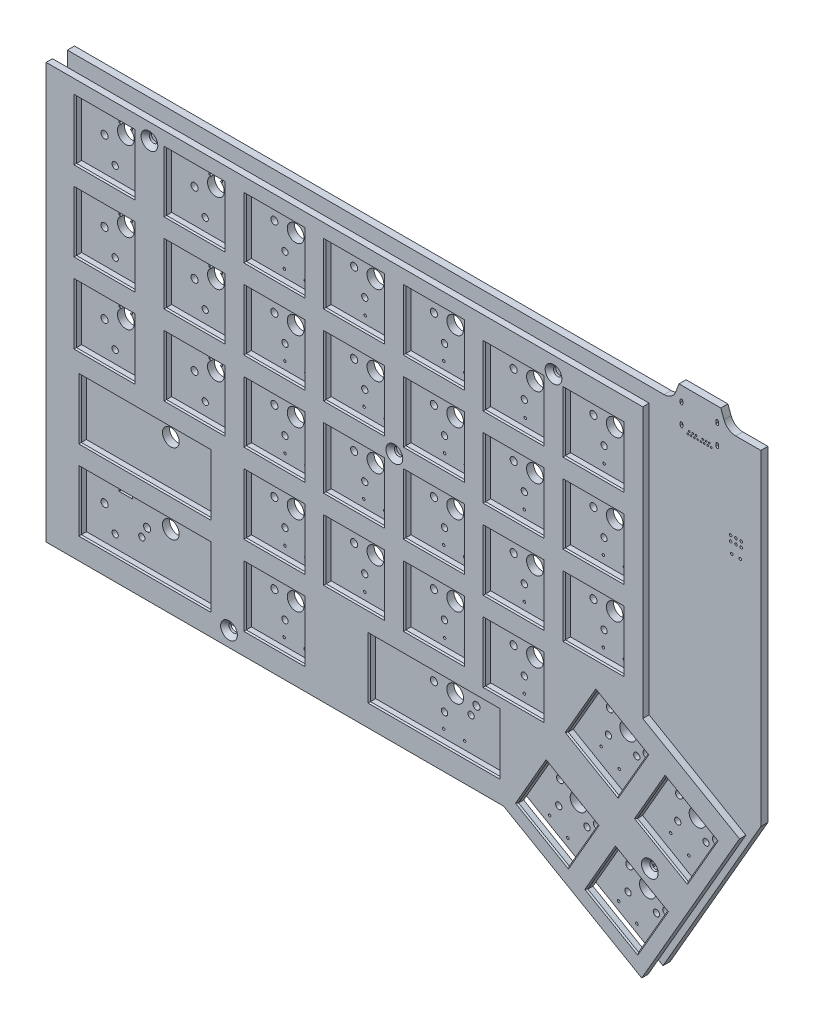
from build123d import *

# Parameters (mm, degrees)
BOSS_EXTRUDE1_START       = -1.69143934
BOSS_EXTRUDE1_OUTLINE_R   = 0.2999994
BOSS_EXTRUDE1_OUTLINE_R_2 = 0.7499985
BOSS_EXTRUDE1_OUTLINE_R_3 = 0.850000024
BOSS_EXTRUDE1_OUTLINE_R_4 = 2
BOSS_EXTRUDE1_OUTLINE_W   = 3.200004578
BOSS_EXTRUDE1_OUTLINE_H   = 2.799999237
BOSS_EXTRUDE1_OUTLINE_W_2 = 3.199996948
BOSS_EXTRUDE1_OUTLINE_H_2 = 2.800003052
BOSS_EXTRUDE1_OUTLINE_W_3 = 3.200000763
BOSS_EXTRUDE1_OUTLINE_W_4 = 3.199999809
BOSS_EXTRUDE1_OUTLINE_H_3 = 2.799995422
BOSS_EXTRUDE1_OUTLINE_R_5 = 0.1999996
BOSS_EXTRUDE1_DEPTH       = 1.69143934
SKETCH2_W                 = 14
SKETCH2_H                 = 14
BOSS_EXTRUDE2_DEPTH       = 5.08
CUT_EXTRUDE1_DEPTH        = 3.556
CHAMFER1_SIZE             = 0.3
SKETCH13_R                = 1
CUT_EXTRUDE5_DEPTH        = 10
CHAMFER2_SIZE             = 1
SKETCH14_W                = 142.472083827
SKETCH14_H                = 1.5
CUT_EXTRUDE6_DEPTH        = 3.556


with BuildPart() as part:
    # Boss-Extrude1: read off the stored shape, not the designer's step
    # Boss-Extrude1 outline → Boss-Extrude1 (new body)
    with BuildSketch(Plane(origin=(0, 0, -1.69143934), x_dir=(-1, 0, 0), z_dir=(0, 0, -1)).offset(BOSS_EXTRUDE1_START)):
        with BuildLine():
            Line((-105.828579714, 28.936268203), (3.414418806, 28.936268203))
            Line((3.414418806, 28.936268203), (3.414418806, 128.136993408))
            Line((3.414418806, 128.136993408), (-139.057665021, 128.136993408))
            ThreePointArc((-139.057665021, 128.136993408), (-140.77192707, 128.675652414), (-141.869995117, 130.098007665))
            Line((-141.869995117, 130.098007665), (-142.623001099, 132.136993871))
            Line((-142.623001099, 132.136993871), (-152.623001099, 132.136993871))
            Line((-152.623001099, 132.136993871), (-153.37600708, 130.098007665))
            ThreePointArc((-153.37600708, 130.098007665), (-154.474075127, 128.675652414), (-156.188337176, 128.136993408))
            Line((-156.188337176, 128.136993408), (-162.162994385, 128.136993408))
            Line((-162.162994385, 128.136993408), (-162.162994385, 50.337001801))
            Line((-162.162994385, 50.337001801), (-138.81300354, 9.892999649))
            Line((-138.81300354, 9.892999649), (-105.828579714, 28.936268203))
        make_face()
        with Locations((-132.5650892, 15.4500072)):
            Circle(BOSS_EXTRUDE1_OUTLINE_R, mode=Mode.SUBTRACT)
        with Locations((-137.2306628, 19.99615)):
            Circle(BOSS_EXTRUDE1_OUTLINE_R_2, mode=Mode.SUBTRACT)
        with Locations((-139.600997925, 21.561000824)):
            Circle(BOSS_EXTRUDE1_OUTLINE_R_3, mode=Mode.SUBTRACT)
        with Locations((-135.201004028, 24.100999832)):
            Circle(BOSS_EXTRUDE1_OUTLINE_R_4, mode=Mode.SUBTRACT)
        with Locations((-128.234948, 17.9499768)):
            Circle(BOSS_EXTRUDE1_OUTLINE_R, mode=Mode.SUBTRACT)
        with Locations((-130.4614104, 20.9714592)):
            Circle(BOSS_EXTRUDE1_OUTLINE_R_2, mode=Mode.SUBTRACT)
        with Locations((-144.9650644, 35.749992)):
            Circle(BOSS_EXTRUDE1_OUTLINE_R, mode=Mode.SUBTRACT)
        Polygon((-137.315002441, 30.962999344), (-135.91521916, 28.537869719), (-138.687222333, 26.937871245), (-140.087005615, 29.36300087), align=None, mode=Mode.SUBTRACT)
        with Locations((-130.802001953, 26.641000748)):
            Circle(BOSS_EXTRUDE1_OUTLINE_R_3, mode=Mode.SUBTRACT)
        with Locations((-123.050003052, 31.108999252)):
            Circle(BOSS_EXTRUDE1_OUTLINE_R_3, mode=Mode.SUBTRACT)
        with Locations((-140.6349232, 38.2500124)):
            Circle(BOSS_EXTRUDE1_OUTLINE_R, mode=Mode.SUBTRACT)
        Polygon((-120.76499939, 40.511001587), (-119.364835204, 38.086092449), (-122.135838927, 36.48609016), (-123.536003113, 38.910999298), align=None, mode=Mode.SUBTRACT)
        with Locations((-116.065046, 24.9500136)):
            Circle(BOSS_EXTRUDE1_OUTLINE_R, mode=Mode.SUBTRACT)
        with Locations((-111.7349556, 27.4499832)):
            Circle(BOSS_EXTRUDE1_OUTLINE_R, mode=Mode.SUBTRACT)
        with Locations((-120.6798196, 29.5438576)):
            Circle(BOSS_EXTRUDE1_OUTLINE_R_2, mode=Mode.SUBTRACT)
        with Locations((-113.9105672, 30.5191668)):
            Circle(BOSS_EXTRUDE1_OUTLINE_R_2, mode=Mode.SUBTRACT)
        with Locations((-118.650001526, 33.64899826)):
            Circle(BOSS_EXTRUDE1_OUTLINE_R_4, mode=Mode.SUBTRACT)
        with Locations((-114.250999451, 36.188999176)):
            Circle(BOSS_EXTRUDE1_OUTLINE_R_3, mode=Mode.SUBTRACT)
        with Locations((-91.4347676, 32.7000108)):
            Circle(BOSS_EXTRUDE1_OUTLINE_R, mode=Mode.SUBTRACT)
        with Locations((-86.4347776, 32.7000108)):
            Circle(BOSS_EXTRUDE1_OUTLINE_R, mode=Mode.SUBTRACT)
        with Locations((-92.9947848, 38.8345172)):
            Circle(BOSS_EXTRUDE1_OUTLINE_R_2, mode=Mode.SUBTRACT)
        with Locations((-86.6447848, 36.2945172)):
            Circle(BOSS_EXTRUDE1_OUTLINE_R_2, mode=Mode.SUBTRACT)
        with Locations((-151.464996338, 42.130001068)):
            Circle(BOSS_EXTRUDE1_OUTLINE_R_3, mode=Mode.SUBTRACT)
        with Locations((-149.095206, 40.5649684)):
            Circle(BOSS_EXTRUDE1_OUTLINE_R_2, mode=Mode.SUBTRACT)
        with Locations((-142.3259536, 41.5402776)):
            Circle(BOSS_EXTRUDE1_OUTLINE_R_2, mode=Mode.SUBTRACT)
        with Locations((-147.065994263, 44.669998169)):
            Circle(BOSS_EXTRUDE1_OUTLINE_R_4, mode=Mode.SUBTRACT)
        with Locations((-142.666000366, 47.209999084)):
            Circle(BOSS_EXTRUDE1_OUTLINE_R_3, mode=Mode.SUBTRACT)
        Polygon((-149.179992676, 51.532001495), (-147.779833289, 49.107093991), (-150.550831546, 47.507099264), (-151.950990933, 49.932006768), align=None, mode=Mode.SUBTRACT)
        with Locations((-128.3650468, 45.3500236)):
            Circle(BOSS_EXTRUDE1_OUTLINE_R, mode=Mode.SUBTRACT)
        with Locations((-124.0349564, 47.8499932)):
            Circle(BOSS_EXTRUDE1_OUTLINE_R, mode=Mode.SUBTRACT)
        with Locations((-134.914001465, 51.678001404)):
            Circle(BOSS_EXTRUDE1_OUTLINE_R_3, mode=Mode.SUBTRACT)
        with Locations((-132.5443628, 50.11293)):
            Circle(BOSS_EXTRUDE1_OUTLINE_R_2, mode=Mode.SUBTRACT)
        with Locations((-125.7750596, 51.0882392)):
            Circle(BOSS_EXTRUDE1_OUTLINE_R_2, mode=Mode.SUBTRACT)
        with Locations((-130.51499939, 54.217998505)):
            Circle(BOSS_EXTRUDE1_OUTLINE_R_4, mode=Mode.SUBTRACT)
        Polygon((-132.628997803, 61.080001831), (-131.228832634, 58.655097666), (-133.999828727, 57.055095377), (-135.399993896, 59.479999542), align=None, mode=Mode.SUBTRACT)
        with Locations((-126.114997864, 56.75799942)):
            Circle(BOSS_EXTRUDE1_OUTLINE_R_3, mode=Mode.SUBTRACT)
        with Locations((-129.5827228, 68.6000152)):
            Circle(BOSS_EXTRUDE1_OUTLINE_R, mode=Mode.SUBTRACT)
        with Locations((-124.582682, 68.6000152)):
            Circle(BOSS_EXTRUDE1_OUTLINE_R, mode=Mode.SUBTRACT)
        with Locations((-110.7000072, 49.6000024)):
            Circle(BOSS_EXTRUDE1_OUTLINE_R, mode=Mode.SUBTRACT)
        with Locations((-105.7000172, 49.6000024)):
            Circle(BOSS_EXTRUDE1_OUTLINE_R, mode=Mode.SUBTRACT)
        with Locations((-105.6947848, 53.2750268)):
            Circle(BOSS_EXTRUDE1_OUTLINE_R_2, mode=Mode.SUBTRACT)
        with Locations((-94.26499939, 41.375)):
            Circle(BOSS_EXTRUDE1_OUTLINE_R_3, mode=Mode.SUBTRACT)
        with Locations((-89.184997559, 41.375)):
            Circle(BOSS_EXTRUDE1_OUTLINE_R_4, mode=Mode.SUBTRACT)
        with Locations((-84.105003357, 41.375)):
            Circle(BOSS_EXTRUDE1_OUTLINE_R_3, mode=Mode.SUBTRACT)
        with Locations((-89.185001373, 46.975000382)):
            Rectangle(BOSS_EXTRUDE1_OUTLINE_W, BOSS_EXTRUDE1_OUTLINE_H, mode=Mode.SUBTRACT)
        with Locations((-91.6447748, 51.5999984)):
            Circle(BOSS_EXTRUDE1_OUTLINE_R, mode=Mode.SUBTRACT)
        with Locations((-86.6447848, 51.5999984)):
            Circle(BOSS_EXTRUDE1_OUTLINE_R, mode=Mode.SUBTRACT)
        with Locations((-86.6447848, 55.3445172)):
            Circle(BOSS_EXTRUDE1_OUTLINE_R_2, mode=Mode.SUBTRACT)
        with Locations((-112.0447848, 55.8150268)):
            Circle(BOSS_EXTRUDE1_OUTLINE_R_2, mode=Mode.SUBTRACT)
        with Locations((-113.315002441, 58.354999542)):
            Circle(BOSS_EXTRUDE1_OUTLINE_R_3, mode=Mode.SUBTRACT)
        with Locations((-108.23500061, 58.354999542)):
            Circle(BOSS_EXTRUDE1_OUTLINE_R_4, mode=Mode.SUBTRACT)
        with Locations((-103.154998779, 58.354999542)):
            Circle(BOSS_EXTRUDE1_OUTLINE_R_3, mode=Mode.SUBTRACT)
        with Locations((-110.7000072, 68.6000152)):
            Circle(BOSS_EXTRUDE1_OUTLINE_R, mode=Mode.SUBTRACT)
        with Locations((-108.23500061, 63.955001831)):
            Rectangle(BOSS_EXTRUDE1_OUTLINE_W_2, BOSS_EXTRUDE1_OUTLINE_H_2, mode=Mode.SUBTRACT)
        with Locations((-105.7000172, 68.6000152)):
            Circle(BOSS_EXTRUDE1_OUTLINE_R, mode=Mode.SUBTRACT)
        with Locations((-92.9947848, 57.8845172)):
            Circle(BOSS_EXTRUDE1_OUTLINE_R_2, mode=Mode.SUBTRACT)
        with Locations((-94.26499939, 60.424999237)):
            Circle(BOSS_EXTRUDE1_OUTLINE_R_3, mode=Mode.SUBTRACT)
        with Locations((-89.184997559, 60.424999237)):
            Circle(BOSS_EXTRUDE1_OUTLINE_R_4, mode=Mode.SUBTRACT)
        with Locations((-84.105003357, 60.424999237)):
            Circle(BOSS_EXTRUDE1_OUTLINE_R_3, mode=Mode.SUBTRACT)
        with Locations((-91.4347676, 70.6999856)):
            Circle(BOSS_EXTRUDE1_OUTLINE_R, mode=Mode.SUBTRACT)
        with Locations((-89.185001373, 66.025001526)):
            Rectangle(BOSS_EXTRUDE1_OUTLINE_W, BOSS_EXTRUDE1_OUTLINE_H_2, mode=Mode.SUBTRACT)
        with Locations((-86.4347776, 70.6999856)):
            Circle(BOSS_EXTRUDE1_OUTLINE_R, mode=Mode.SUBTRACT)
        with Locations((-53.3347676, 32.5999856)):
            Circle(BOSS_EXTRUDE1_OUTLINE_R, mode=Mode.SUBTRACT)
        with Locations((-48.3347776, 32.5999856)):
            Circle(BOSS_EXTRUDE1_OUTLINE_R, mode=Mode.SUBTRACT)
        with Locations((-48.5447848, 36.2945172)):
            Circle(BOSS_EXTRUDE1_OUTLINE_R_2, mode=Mode.SUBTRACT)
        with Locations((-54.8947848, 38.8345172)):
            Circle(BOSS_EXTRUDE1_OUTLINE_R_2, mode=Mode.SUBTRACT)
        with Locations((-34.2847676, 30.100016)):
            Circle(BOSS_EXTRUDE1_OUTLINE_R, mode=Mode.SUBTRACT)
        with Locations((-29.2847776, 30.100016)):
            Circle(BOSS_EXTRUDE1_OUTLINE_R, mode=Mode.SUBTRACT)
        with Locations((-12.9947924, 30.100016)):
            Circle(BOSS_EXTRUDE1_OUTLINE_R, mode=Mode.SUBTRACT)
        with Locations((-7.9948024, 30.100016)):
            Circle(BOSS_EXTRUDE1_OUTLINE_R, mode=Mode.SUBTRACT)
        with Locations((-14.3448024, 36.3265212)):
            Circle(BOSS_EXTRUDE1_OUTLINE_R_2, mode=Mode.SUBTRACT)
        with Locations((-7.9948024, 33.7865212)):
            Circle(BOSS_EXTRUDE1_OUTLINE_R_2, mode=Mode.SUBTRACT)
        with Locations((-15.614999771, 38.86700058)):
            Circle(BOSS_EXTRUDE1_OUTLINE_R_3, mode=Mode.SUBTRACT)
        with Locations((-5.454999924, 38.86700058)):
            Circle(BOSS_EXTRUDE1_OUTLINE_R_3, mode=Mode.SUBTRACT)
        with Locations((-72.5947748, 51.5999984)):
            Circle(BOSS_EXTRUDE1_OUTLINE_R, mode=Mode.SUBTRACT)
        with Locations((-67.5947848, 51.5999984)):
            Circle(BOSS_EXTRUDE1_OUTLINE_R, mode=Mode.SUBTRACT)
        with Locations((-67.5947848, 55.3445172)):
            Circle(BOSS_EXTRUDE1_OUTLINE_R_2, mode=Mode.SUBTRACT)
        with Locations((-56.165000916, 41.375)):
            Circle(BOSS_EXTRUDE1_OUTLINE_R_3, mode=Mode.SUBTRACT)
        with Locations((-51.084999084, 41.375)):
            Circle(BOSS_EXTRUDE1_OUTLINE_R_4, mode=Mode.SUBTRACT)
        with Locations((-51.085000992, 46.975000382)):
            Rectangle(BOSS_EXTRUDE1_OUTLINE_W_3, BOSS_EXTRUDE1_OUTLINE_H, mode=Mode.SUBTRACT)
        with Locations((-46.005001068, 41.375)):
            Circle(BOSS_EXTRUDE1_OUTLINE_R_3, mode=Mode.SUBTRACT)
        with Locations((-53.542692, 51.5999984)):
            Circle(BOSS_EXTRUDE1_OUTLINE_R, mode=Mode.SUBTRACT)
        with Locations((-48.542702, 51.5999984)):
            Circle(BOSS_EXTRUDE1_OUTLINE_R, mode=Mode.SUBTRACT)
        with Locations((-48.5447848, 55.3445172)):
            Circle(BOSS_EXTRUDE1_OUTLINE_R_2, mode=Mode.SUBTRACT)
        with Locations((-73.9447848, 57.8845172)):
            Circle(BOSS_EXTRUDE1_OUTLINE_R_2, mode=Mode.SUBTRACT)
        with Locations((-75.214996338, 60.424999237)):
            Circle(BOSS_EXTRUDE1_OUTLINE_R_3, mode=Mode.SUBTRACT)
        with Locations((-70.135002136, 60.424999237)):
            Circle(BOSS_EXTRUDE1_OUTLINE_R_4, mode=Mode.SUBTRACT)
        with Locations((-65.055000305, 60.424999237)):
            Circle(BOSS_EXTRUDE1_OUTLINE_R_3, mode=Mode.SUBTRACT)
        with Locations((-70.135002136, 66.025001526)):
            Rectangle(BOSS_EXTRUDE1_OUTLINE_W_2, BOSS_EXTRUDE1_OUTLINE_H_2, mode=Mode.SUBTRACT)
        with Locations((-72.3847676, 70.6999856)):
            Circle(BOSS_EXTRUDE1_OUTLINE_R, mode=Mode.SUBTRACT)
        with Locations((-67.3847776, 70.6999856)):
            Circle(BOSS_EXTRUDE1_OUTLINE_R, mode=Mode.SUBTRACT)
        with Locations((-54.8947848, 57.8845172)):
            Circle(BOSS_EXTRUDE1_OUTLINE_R_2, mode=Mode.SUBTRACT)
        with Locations((-56.165000916, 60.424999237)):
            Circle(BOSS_EXTRUDE1_OUTLINE_R_3, mode=Mode.SUBTRACT)
        with Locations((-51.084999084, 60.424999237)):
            Circle(BOSS_EXTRUDE1_OUTLINE_R_4, mode=Mode.SUBTRACT)
        with Locations((-46.005001068, 60.424999237)):
            Circle(BOSS_EXTRUDE1_OUTLINE_R_3, mode=Mode.SUBTRACT)
        with Locations((-51.085000992, 66.025001526)):
            Rectangle(BOSS_EXTRUDE1_OUTLINE_W_3, BOSS_EXTRUDE1_OUTLINE_H_2, mode=Mode.SUBTRACT)
        with Locations((-53.542692, 70.6999856)):
            Circle(BOSS_EXTRUDE1_OUTLINE_R, mode=Mode.SUBTRACT)
        with Locations((-48.542702, 70.6999856)):
            Circle(BOSS_EXTRUDE1_OUTLINE_R, mode=Mode.SUBTRACT)
        with Locations((-21.284999847, 41.375)):
            Circle(BOSS_EXTRUDE1_OUTLINE_R_4, mode=Mode.SUBTRACT)
        with Locations((-34.4947748, 49.2000032)):
            Circle(BOSS_EXTRUDE1_OUTLINE_R, mode=Mode.SUBTRACT)
        with Locations((-29.4947848, 49.2000032)):
            Circle(BOSS_EXTRUDE1_OUTLINE_R, mode=Mode.SUBTRACT)
        with Locations((-10.535000325, 44.467000962)):
            Rectangle(BOSS_EXTRUDE1_OUTLINE_W_4, BOSS_EXTRUDE1_OUTLINE_H, mode=Mode.SUBTRACT)
        with Locations((-12.9947924, 49.2000032)):
            Circle(BOSS_EXTRUDE1_OUTLINE_R, mode=Mode.SUBTRACT)
        with Locations((-7.9948024, 49.2000032)):
            Circle(BOSS_EXTRUDE1_OUTLINE_R, mode=Mode.SUBTRACT)
        with Locations((-21.284999847, 60.424999237)):
            Circle(BOSS_EXTRUDE1_OUTLINE_R_4, mode=Mode.SUBTRACT)
        with Locations((-34.4947748, 68.200016)):
            Circle(BOSS_EXTRUDE1_OUTLINE_R, mode=Mode.SUBTRACT)
        with Locations((-29.4947848, 68.200016)):
            Circle(BOSS_EXTRUDE1_OUTLINE_R, mode=Mode.SUBTRACT)
        with Locations((-12.7847852, 68.200016)):
            Circle(BOSS_EXTRUDE1_OUTLINE_R, mode=Mode.SUBTRACT)
        with Locations((-7.7847952, 68.200016)):
            Circle(BOSS_EXTRUDE1_OUTLINE_R, mode=Mode.SUBTRACT)
        with Locations((-132.365005493, 77.404998779)):
            Circle(BOSS_EXTRUDE1_OUTLINE_R_3, mode=Mode.SUBTRACT)
        with Locations((-124.7447848, 72.3250268)):
            Circle(BOSS_EXTRUDE1_OUTLINE_R_2, mode=Mode.SUBTRACT)
        with Locations((-131.0947848, 74.8650268)):
            Circle(BOSS_EXTRUDE1_OUTLINE_R_2, mode=Mode.SUBTRACT)
        with Locations((-127.285003662, 77.404998779)):
            Circle(BOSS_EXTRUDE1_OUTLINE_R_4, mode=Mode.SUBTRACT)
        with Locations((-122.205001831, 77.404998779)):
            Circle(BOSS_EXTRUDE1_OUTLINE_R_3, mode=Mode.SUBTRACT)
        with Locations((-127.284996033, 83.005001068)):
            Rectangle(BOSS_EXTRUDE1_OUTLINE_W_2, BOSS_EXTRUDE1_OUTLINE_H_3, mode=Mode.SUBTRACT)
        with Locations((-129.5827228, 87.7000024)):
            Circle(BOSS_EXTRUDE1_OUTLINE_R, mode=Mode.SUBTRACT)
        with Locations((-124.582682, 87.7000024)):
            Circle(BOSS_EXTRUDE1_OUTLINE_R, mode=Mode.SUBTRACT)
        with Locations((-131.092702, 93.9152808)):
            Circle(BOSS_EXTRUDE1_OUTLINE_R_2, mode=Mode.SUBTRACT)
        with Locations((-124.742702, 91.3752808)):
            Circle(BOSS_EXTRUDE1_OUTLINE_R_2, mode=Mode.SUBTRACT)
        with Locations((-132.363006592, 96.455001831)):
            Circle(BOSS_EXTRUDE1_OUTLINE_R_3, mode=Mode.SUBTRACT)
        with Locations((-127.282997131, 96.455001831)):
            Circle(BOSS_EXTRUDE1_OUTLINE_R_4, mode=Mode.SUBTRACT)
        with Locations((-122.20300293, 96.455001831)):
            Circle(BOSS_EXTRUDE1_OUTLINE_R_3, mode=Mode.SUBTRACT)
        with Locations((-112.0447848, 74.8650268)):
            Circle(BOSS_EXTRUDE1_OUTLINE_R_2, mode=Mode.SUBTRACT)
        with Locations((-113.315002441, 77.404998779)):
            Circle(BOSS_EXTRUDE1_OUTLINE_R_3, mode=Mode.SUBTRACT)
        with Locations((-105.6947848, 72.3250268)):
            Circle(BOSS_EXTRUDE1_OUTLINE_R_2, mode=Mode.SUBTRACT)
        with Locations((-108.23500061, 77.404998779)):
            Circle(BOSS_EXTRUDE1_OUTLINE_R_4, mode=Mode.SUBTRACT)
        with Locations((-103.154998779, 77.404998779)):
            Circle(BOSS_EXTRUDE1_OUTLINE_R_3, mode=Mode.SUBTRACT)
        with Locations((-108.23500061, 83.005001068)):
            Rectangle(BOSS_EXTRUDE1_OUTLINE_W_2, BOSS_EXTRUDE1_OUTLINE_H_3, mode=Mode.SUBTRACT)
        with Locations((-92.9947848, 76.9345172)):
            Circle(BOSS_EXTRUDE1_OUTLINE_R_2, mode=Mode.SUBTRACT)
        with Locations((-86.6447848, 74.3945172)):
            Circle(BOSS_EXTRUDE1_OUTLINE_R_2, mode=Mode.SUBTRACT)
        with Locations((-94.26499939, 79.474998474)):
            Circle(BOSS_EXTRUDE1_OUTLINE_R_3, mode=Mode.SUBTRACT)
        with Locations((-89.184997559, 79.474998474)):
            Circle(BOSS_EXTRUDE1_OUTLINE_R_4, mode=Mode.SUBTRACT)
        with Locations((-84.105003357, 79.474998474)):
            Circle(BOSS_EXTRUDE1_OUTLINE_R_3, mode=Mode.SUBTRACT)
        with Locations((-89.185001373, 85.075000763)):
            Rectangle(BOSS_EXTRUDE1_OUTLINE_W, BOSS_EXTRUDE1_OUTLINE_H_3, mode=Mode.SUBTRACT)
        with Locations((-110.7000072, 87.7000024)):
            Circle(BOSS_EXTRUDE1_OUTLINE_R, mode=Mode.SUBTRACT)
        with Locations((-112.042702, 93.9152808)):
            Circle(BOSS_EXTRUDE1_OUTLINE_R_2, mode=Mode.SUBTRACT)
        with Locations((-105.7000172, 87.7000024)):
            Circle(BOSS_EXTRUDE1_OUTLINE_R, mode=Mode.SUBTRACT)
        with Locations((-105.692702, 91.3752808)):
            Circle(BOSS_EXTRUDE1_OUTLINE_R_2, mode=Mode.SUBTRACT)
        with Locations((-113.31300354, 96.455001831)):
            Circle(BOSS_EXTRUDE1_OUTLINE_R_3, mode=Mode.SUBTRACT)
        with Locations((-108.233001709, 96.455001831)):
            Circle(BOSS_EXTRUDE1_OUTLINE_R_4, mode=Mode.SUBTRACT)
        with Locations((-103.152999878, 96.455001831)):
            Circle(BOSS_EXTRUDE1_OUTLINE_R_3, mode=Mode.SUBTRACT)
        with Locations((-91.642692, 89.8000236)):
            Circle(BOSS_EXTRUDE1_OUTLINE_R, mode=Mode.SUBTRACT)
        with Locations((-86.642702, 89.8000236)):
            Circle(BOSS_EXTRUDE1_OUTLINE_R, mode=Mode.SUBTRACT)
        with Locations((-86.6447848, 93.4445172)):
            Circle(BOSS_EXTRUDE1_OUTLINE_R_2, mode=Mode.SUBTRACT)
        with Locations((-92.9947848, 95.9845172)):
            Circle(BOSS_EXTRUDE1_OUTLINE_R_2, mode=Mode.SUBTRACT)
        with Locations((-94.26499939, 98.525001526)):
            Circle(BOSS_EXTRUDE1_OUTLINE_R_3, mode=Mode.SUBTRACT)
        with Locations((-89.184997559, 98.525001526)):
            Circle(BOSS_EXTRUDE1_OUTLINE_R_4, mode=Mode.SUBTRACT)
        with Locations((-84.105003357, 98.525001526)):
            Circle(BOSS_EXTRUDE1_OUTLINE_R_3, mode=Mode.SUBTRACT)
        with Locations((-157.2500284, 103.249984)):
            Circle(BOSS_EXTRUDE1_OUTLINE_R, mode=Mode.SUBTRACT)
        with Locations((-155.2500324, 103.249984)):
            Circle(BOSS_EXTRUDE1_OUTLINE_R, mode=Mode.SUBTRACT)
        with Locations((-157.5000152, 105.7299892)):
            Circle(BOSS_EXTRUDE1_OUTLINE_R, mode=Mode.SUBTRACT)
        with Locations((-157.5000152, 106.9999892)):
            Circle(BOSS_EXTRUDE1_OUTLINE_R, mode=Mode.SUBTRACT)
        with Locations((-156.2300152, 105.7299892)):
            Circle(BOSS_EXTRUDE1_OUTLINE_R, mode=Mode.SUBTRACT)
        with Locations((-154.9600152, 105.7299892)):
            Circle(BOSS_EXTRUDE1_OUTLINE_R, mode=Mode.SUBTRACT)
        with Locations((-156.2300152, 106.9999892)):
            Circle(BOSS_EXTRUDE1_OUTLINE_R, mode=Mode.SUBTRACT)
        with Locations((-154.9600152, 106.9999892)):
            Circle(BOSS_EXTRUDE1_OUTLINE_R, mode=Mode.SUBTRACT)
        with Locations((-127.282997131, 102.055000305)):
            Rectangle(BOSS_EXTRUDE1_OUTLINE_W_2, BOSS_EXTRUDE1_OUTLINE_H_2, mode=Mode.SUBTRACT)
        with Locations((-129.742692, 106.7000152)):
            Circle(BOSS_EXTRUDE1_OUTLINE_R, mode=Mode.SUBTRACT)
        with Locations((-124.742702, 106.7000152)):
            Circle(BOSS_EXTRUDE1_OUTLINE_R, mode=Mode.SUBTRACT)
        with Locations((-132.363006592, 115.504997253)):
            Circle(BOSS_EXTRUDE1_OUTLINE_R_3, mode=Mode.SUBTRACT)
        with Locations((-131.092702, 112.9652808)):
            Circle(BOSS_EXTRUDE1_OUTLINE_R_2, mode=Mode.SUBTRACT)
        with Locations((-124.742702, 110.4252808)):
            Circle(BOSS_EXTRUDE1_OUTLINE_R_2, mode=Mode.SUBTRACT)
        with Locations((-127.282997131, 115.504997253)):
            Circle(BOSS_EXTRUDE1_OUTLINE_R_4, mode=Mode.SUBTRACT)
        with Locations((-122.20300293, 115.504997253)):
            Circle(BOSS_EXTRUDE1_OUTLINE_R_3, mode=Mode.SUBTRACT)
        with Locations((-150.2999788, 122.8200236)):
            Circle(BOSS_EXTRUDE1_OUTLINE_R_5, mode=Mode.SUBTRACT)
        with Locations((-149.4999804, 122.8200236)):
            Circle(BOSS_EXTRUDE1_OUTLINE_R_5, mode=Mode.SUBTRACT)
        with Locations((-149.8999796, 123.5199968)):
            Circle(BOSS_EXTRUDE1_OUTLINE_R_5, mode=Mode.SUBTRACT)
        with BuildLine():
            ThreePointArc((-151.469979, 123.6699838), (-151.7699784, 123.3699844), (-152.0699778, 123.6699838))
            Line((-152.0699778, 123.6699838), (-152.0699778, 124.2699826))
            ThreePointArc((-152.0699778, 124.2699826), (-151.7699784, 124.569982), (-151.469979, 124.2699826))
            Line((-151.469979, 124.2699826), (-151.469979, 123.6699838))
        make_face(mode=Mode.SUBTRACT)
        with Locations((-148.699982, 122.8200236)):
            Circle(BOSS_EXTRUDE1_OUTLINE_R_5, mode=Mode.SUBTRACT)
        with Locations((-149.0999812, 123.5199968)):
            Circle(BOSS_EXTRUDE1_OUTLINE_R_5, mode=Mode.SUBTRACT)
        with Locations((-148.2999828, 123.5199968)):
            Circle(BOSS_EXTRUDE1_OUTLINE_R_5, mode=Mode.SUBTRACT)
        with Locations((-147.8999836, 122.8200236)):
            Circle(BOSS_EXTRUDE1_OUTLINE_R_5, mode=Mode.SUBTRACT)
        with Locations((-147.0999852, 122.8200236)):
            Circle(BOSS_EXTRUDE1_OUTLINE_R_5, mode=Mode.SUBTRACT)
        with Locations((-146.699986, 123.5199968)):
            Circle(BOSS_EXTRUDE1_OUTLINE_R_5, mode=Mode.SUBTRACT)
        with Locations((-146.2999868, 122.8200236)):
            Circle(BOSS_EXTRUDE1_OUTLINE_R_5, mode=Mode.SUBTRACT)
        with Locations((-145.4999884, 122.8200236)):
            Circle(BOSS_EXTRUDE1_OUTLINE_R_5, mode=Mode.SUBTRACT)
        with Locations((-145.8999876, 123.5199968)):
            Circle(BOSS_EXTRUDE1_OUTLINE_R_5, mode=Mode.SUBTRACT)
        with Locations((-144.69999, 122.8200236)):
            Circle(BOSS_EXTRUDE1_OUTLINE_R_5, mode=Mode.SUBTRACT)
        with Locations((-145.0999892, 123.5199968)):
            Circle(BOSS_EXTRUDE1_OUTLINE_R_5, mode=Mode.SUBTRACT)
        with BuildLine():
            ThreePointArc((-142.929991, 123.6699838), (-143.2299904, 123.3699844), (-143.5299898, 123.6699838))
            Line((-143.5299898, 123.6699838), (-143.5299898, 124.2699826))
            ThreePointArc((-143.5299898, 124.2699826), (-143.2299904, 124.569982), (-142.929991, 124.2699826))
            Line((-142.929991, 124.2699826), (-142.929991, 123.6699838))
        make_face(mode=Mode.SUBTRACT)
        with BuildLine():
            ThreePointArc((-151.469979, 128.4000226), (-151.7699784, 128.1000232), (-152.0699778, 128.4000226))
            Line((-152.0699778, 128.4000226), (-152.0699778, 129.0000214))
            ThreePointArc((-152.0699778, 129.0000214), (-151.7699784, 129.3000208), (-151.469979, 129.0000214))
            Line((-151.469979, 129.0000214), (-151.469979, 128.4000226))
        make_face(mode=Mode.SUBTRACT)
        with BuildLine():
            ThreePointArc((-142.929991, 128.4000226), (-143.2299904, 128.1000232), (-143.5299898, 128.4000226))
            Line((-143.5299898, 128.4000226), (-143.5299898, 129.0000214))
            ThreePointArc((-143.5299898, 129.0000214), (-143.2299904, 129.3000208), (-142.929991, 129.0000214))
            Line((-142.929991, 129.0000214), (-142.929991, 128.4000226))
        make_face(mode=Mode.SUBTRACT)
        with Locations((-127.282997131, 121.104999542)):
            Rectangle(BOSS_EXTRUDE1_OUTLINE_W_2, BOSS_EXTRUDE1_OUTLINE_H_3, mode=Mode.SUBTRACT)
        with Locations((-110.932722, 106.7000152)):
            Circle(BOSS_EXTRUDE1_OUTLINE_R, mode=Mode.SUBTRACT)
        with Locations((-108.233001709, 102.055000305)):
            Rectangle(BOSS_EXTRUDE1_OUTLINE_W_2, BOSS_EXTRUDE1_OUTLINE_H_2, mode=Mode.SUBTRACT)
        with Locations((-105.9326812, 106.7000152)):
            Circle(BOSS_EXTRUDE1_OUTLINE_R, mode=Mode.SUBTRACT)
        with Locations((-112.042702, 112.9652808)):
            Circle(BOSS_EXTRUDE1_OUTLINE_R_2, mode=Mode.SUBTRACT)
        with Locations((-113.31300354, 115.504997253)):
            Circle(BOSS_EXTRUDE1_OUTLINE_R_3, mode=Mode.SUBTRACT)
        with Locations((-105.692702, 110.4252808)):
            Circle(BOSS_EXTRUDE1_OUTLINE_R_2, mode=Mode.SUBTRACT)
        with Locations((-108.233001709, 115.504997253)):
            Circle(BOSS_EXTRUDE1_OUTLINE_R_4, mode=Mode.SUBTRACT)
        with Locations((-103.152999878, 115.504997253)):
            Circle(BOSS_EXTRUDE1_OUTLINE_R_3, mode=Mode.SUBTRACT)
        with Locations((-91.4827228, 108.7999856)):
            Circle(BOSS_EXTRUDE1_OUTLINE_R, mode=Mode.SUBTRACT)
        with Locations((-89.185001373, 104.125)):
            Rectangle(BOSS_EXTRUDE1_OUTLINE_W, BOSS_EXTRUDE1_OUTLINE_H_2, mode=Mode.SUBTRACT)
        with Locations((-86.482682, 108.7999856)):
            Circle(BOSS_EXTRUDE1_OUTLINE_R, mode=Mode.SUBTRACT)
        with Locations((-92.992702, 115.0347712)):
            Circle(BOSS_EXTRUDE1_OUTLINE_R_2, mode=Mode.SUBTRACT)
        with Locations((-86.642702, 112.4947712)):
            Circle(BOSS_EXTRUDE1_OUTLINE_R_2, mode=Mode.SUBTRACT)
        with Locations((-108.233001709, 121.104999542)):
            Rectangle(BOSS_EXTRUDE1_OUTLINE_W_2, BOSS_EXTRUDE1_OUTLINE_H_3, mode=Mode.SUBTRACT)
        with Locations((-94.263000488, 117.574996948)):
            Circle(BOSS_EXTRUDE1_OUTLINE_R_3, mode=Mode.SUBTRACT)
        with Locations((-89.182998657, 117.574996948)):
            Circle(BOSS_EXTRUDE1_OUTLINE_R_4, mode=Mode.SUBTRACT)
        with Locations((-84.102996826, 117.574996948)):
            Circle(BOSS_EXTRUDE1_OUTLINE_R_3, mode=Mode.SUBTRACT)
        with Locations((-89.182998657, 123.174999237)):
            Rectangle(BOSS_EXTRUDE1_OUTLINE_W_2, BOSS_EXTRUDE1_OUTLINE_H_3, mode=Mode.SUBTRACT)
        with Locations((-73.9447848, 76.9345172)):
            Circle(BOSS_EXTRUDE1_OUTLINE_R_2, mode=Mode.SUBTRACT)
        with Locations((-67.5947848, 74.3945172)):
            Circle(BOSS_EXTRUDE1_OUTLINE_R_2, mode=Mode.SUBTRACT)
        with Locations((-75.214996338, 79.474998474)):
            Circle(BOSS_EXTRUDE1_OUTLINE_R_3, mode=Mode.SUBTRACT)
        with Locations((-70.135002136, 79.474998474)):
            Circle(BOSS_EXTRUDE1_OUTLINE_R_4, mode=Mode.SUBTRACT)
        with Locations((-70.135002136, 85.075000763)):
            Rectangle(BOSS_EXTRUDE1_OUTLINE_W_2, BOSS_EXTRUDE1_OUTLINE_H_3, mode=Mode.SUBTRACT)
        with Locations((-65.055000305, 79.474998474)):
            Circle(BOSS_EXTRUDE1_OUTLINE_R_3, mode=Mode.SUBTRACT)
        with Locations((-48.5447848, 74.3945172)):
            Circle(BOSS_EXTRUDE1_OUTLINE_R_2, mode=Mode.SUBTRACT)
        with Locations((-54.8947848, 76.9345172)):
            Circle(BOSS_EXTRUDE1_OUTLINE_R_2, mode=Mode.SUBTRACT)
        with Locations((-56.165000916, 79.474998474)):
            Circle(BOSS_EXTRUDE1_OUTLINE_R_3, mode=Mode.SUBTRACT)
        with Locations((-51.084999084, 79.474998474)):
            Circle(BOSS_EXTRUDE1_OUTLINE_R_4, mode=Mode.SUBTRACT)
        with Locations((-51.085000992, 85.075000763)):
            Rectangle(BOSS_EXTRUDE1_OUTLINE_W_3, BOSS_EXTRUDE1_OUTLINE_H_3, mode=Mode.SUBTRACT)
        with Locations((-46.005001068, 79.474998474)):
            Circle(BOSS_EXTRUDE1_OUTLINE_R_3, mode=Mode.SUBTRACT)
        with Locations((-72.4348056, 89.8000236)):
            Circle(BOSS_EXTRUDE1_OUTLINE_R, mode=Mode.SUBTRACT)
        with Locations((-67.4347648, 89.8000236)):
            Circle(BOSS_EXTRUDE1_OUTLINE_R, mode=Mode.SUBTRACT)
        with Locations((-67.5947848, 93.4445172)):
            Circle(BOSS_EXTRUDE1_OUTLINE_R_2, mode=Mode.SUBTRACT)
        with Locations((-73.9447848, 95.9845172)):
            Circle(BOSS_EXTRUDE1_OUTLINE_R_2, mode=Mode.SUBTRACT)
        with Locations((-75.214996338, 98.525001526)):
            Circle(BOSS_EXTRUDE1_OUTLINE_R_3, mode=Mode.SUBTRACT)
        with Locations((-70.135002136, 98.525001526)):
            Circle(BOSS_EXTRUDE1_OUTLINE_R_4, mode=Mode.SUBTRACT)
        with Locations((-65.055000305, 98.525001526)):
            Circle(BOSS_EXTRUDE1_OUTLINE_R_3, mode=Mode.SUBTRACT)
        with Locations((-53.542692, 89.8000236)):
            Circle(BOSS_EXTRUDE1_OUTLINE_R, mode=Mode.SUBTRACT)
        with Locations((-48.542702, 89.8000236)):
            Circle(BOSS_EXTRUDE1_OUTLINE_R, mode=Mode.SUBTRACT)
        with Locations((-48.5447848, 93.4445172)):
            Circle(BOSS_EXTRUDE1_OUTLINE_R_2, mode=Mode.SUBTRACT)
        with Locations((-54.8947848, 95.9845172)):
            Circle(BOSS_EXTRUDE1_OUTLINE_R_2, mode=Mode.SUBTRACT)
        with Locations((-56.165000916, 98.525001526)):
            Circle(BOSS_EXTRUDE1_OUTLINE_R_3, mode=Mode.SUBTRACT)
        with Locations((-51.084999084, 98.525001526)):
            Circle(BOSS_EXTRUDE1_OUTLINE_R_4, mode=Mode.SUBTRACT)
        with Locations((-46.005001068, 98.525001526)):
            Circle(BOSS_EXTRUDE1_OUTLINE_R_3, mode=Mode.SUBTRACT)
        with Locations((-35.8447848, 74.4265212)):
            Circle(BOSS_EXTRUDE1_OUTLINE_R_2, mode=Mode.SUBTRACT)
        with Locations((-29.4947848, 71.8865212)):
            Circle(BOSS_EXTRUDE1_OUTLINE_R_2, mode=Mode.SUBTRACT)
        with Locations((-37.115001678, 76.967002869)):
            Circle(BOSS_EXTRUDE1_OUTLINE_R_3, mode=Mode.SUBTRACT)
        with Locations((-26.954999924, 76.967002869)):
            Circle(BOSS_EXTRUDE1_OUTLINE_R_3, mode=Mode.SUBTRACT)
        with BuildLine():
            Line((-30.434999466, 81.166999817), (-30.968636187, 81.166999817))
            ThreePointArc((-30.968636187, 81.166999817), (-32.034999847, 77.474998474), (-33.101363508, 81.166999817))
            Line((-33.101363508, 81.166999817), (-33.634998322, 81.166999817))
            Line((-33.634998322, 81.166999817), (-33.634998322, 83.967002869))
            Line((-33.634998322, 83.967002869), (-30.434999466, 83.967002869))
            Line((-30.434999466, 83.967002869), (-30.434999466, 81.166999817))
        make_face(mode=Mode.SUBTRACT)
        with Locations((-14.3448024, 74.4265212)):
            Circle(BOSS_EXTRUDE1_OUTLINE_R_2, mode=Mode.SUBTRACT)
        with Locations((-7.9948024, 71.8865212)):
            Circle(BOSS_EXTRUDE1_OUTLINE_R_2, mode=Mode.SUBTRACT)
        with Locations((-15.614999771, 76.967002869)):
            Circle(BOSS_EXTRUDE1_OUTLINE_R_3, mode=Mode.SUBTRACT)
        with Locations((-5.454999924, 76.967002869)):
            Circle(BOSS_EXTRUDE1_OUTLINE_R_3, mode=Mode.SUBTRACT)
        with BuildLine():
            Line((-8.93500042, 81.166999817), (-9.468636187, 81.166999817))
            ThreePointArc((-9.468636187, 81.166999817), (-10.534999847, 77.474998474), (-11.601363508, 81.166999817))
            Line((-11.601363508, 81.166999817), (-12.135000229, 81.166999817))
            Line((-12.135000229, 81.166999817), (-12.135000229, 83.967002869))
            Line((-12.135000229, 83.967002869), (-8.93500042, 83.967002869))
            Line((-8.93500042, 83.967002869), (-8.93500042, 81.166999817))
        make_face(mode=Mode.SUBTRACT)
        with Locations((-34.4947748, 87.3000032)):
            Circle(BOSS_EXTRUDE1_OUTLINE_R, mode=Mode.SUBTRACT)
        with Locations((-29.4947848, 87.3000032)):
            Circle(BOSS_EXTRUDE1_OUTLINE_R, mode=Mode.SUBTRACT)
        with Locations((-35.8447848, 93.4765212)):
            Circle(BOSS_EXTRUDE1_OUTLINE_R_2, mode=Mode.SUBTRACT)
        with Locations((-29.4947848, 90.9365212)):
            Circle(BOSS_EXTRUDE1_OUTLINE_R_2, mode=Mode.SUBTRACT)
        with Locations((-37.115001678, 96.016998291)):
            Circle(BOSS_EXTRUDE1_OUTLINE_R_3, mode=Mode.SUBTRACT)
        with BuildLine():
            Line((-30.434999466, 100.217002869), (-30.968636187, 100.217002869))
            ThreePointArc((-30.968636187, 100.217002869), (-32.034999847, 96.525001526), (-33.101363508, 100.217002869))
            Line((-33.101363508, 100.217002869), (-33.634998322, 100.217002869))
            Line((-33.634998322, 100.217002869), (-33.634998322, 103.016998291))
            Line((-33.634998322, 103.016998291), (-30.434999466, 103.016998291))
            Line((-30.434999466, 103.016998291), (-30.434999466, 100.217002869))
        make_face(mode=Mode.SUBTRACT)
        with Locations((-26.954999924, 96.016998291)):
            Circle(BOSS_EXTRUDE1_OUTLINE_R_3, mode=Mode.SUBTRACT)
        with Locations((-12.8347724, 87.3000032)):
            Circle(BOSS_EXTRUDE1_OUTLINE_R, mode=Mode.SUBTRACT)
        with Locations((-7.8347824, 87.3000032)):
            Circle(BOSS_EXTRUDE1_OUTLINE_R, mode=Mode.SUBTRACT)
        with Locations((-14.3448024, 93.4765212)):
            Circle(BOSS_EXTRUDE1_OUTLINE_R_2, mode=Mode.SUBTRACT)
        with Locations((-7.9948024, 90.9365212)):
            Circle(BOSS_EXTRUDE1_OUTLINE_R_2, mode=Mode.SUBTRACT)
        with Locations((-15.614999771, 96.016998291)):
            Circle(BOSS_EXTRUDE1_OUTLINE_R_3, mode=Mode.SUBTRACT)
        with BuildLine():
            ThreePointArc((-9.468636187, 100.217002869), (-10.534999847, 96.525001526), (-11.601363508, 100.217002869))
            Line((-11.601363508, 100.217002869), (-12.135000229, 100.217002869))
            Line((-12.135000229, 100.217002869), (-12.135000229, 103.016998291))
            Line((-12.135000229, 103.016998291), (-8.93500042, 103.016998291))
            Line((-8.93500042, 103.016998291), (-8.93500042, 100.217002869))
            Line((-8.93500042, 100.217002869), (-9.468636187, 100.217002869))
        make_face(mode=Mode.SUBTRACT)
        with Locations((-5.454999924, 96.016998291)):
            Circle(BOSS_EXTRUDE1_OUTLINE_R_3, mode=Mode.SUBTRACT)
        with Locations((-70.135002136, 104.125)):
            Rectangle(BOSS_EXTRUDE1_OUTLINE_W_2, BOSS_EXTRUDE1_OUTLINE_H_2, mode=Mode.SUBTRACT)
        with Locations((-72.6999816, 108.7999856)):
            Circle(BOSS_EXTRUDE1_OUTLINE_R, mode=Mode.SUBTRACT)
        with Locations((-67.6999916, 108.7999856)):
            Circle(BOSS_EXTRUDE1_OUTLINE_R, mode=Mode.SUBTRACT)
        with Locations((-73.942702, 115.0347712)):
            Circle(BOSS_EXTRUDE1_OUTLINE_R_2, mode=Mode.SUBTRACT)
        with Locations((-67.592702, 112.4947712)):
            Circle(BOSS_EXTRUDE1_OUTLINE_R_2, mode=Mode.SUBTRACT)
        with Locations((-51.085000992, 104.125)):
            Rectangle(BOSS_EXTRUDE1_OUTLINE_W_3, BOSS_EXTRUDE1_OUTLINE_H_2, mode=Mode.SUBTRACT)
        with Locations((-53.3827228, 108.7999856)):
            Circle(BOSS_EXTRUDE1_OUTLINE_R, mode=Mode.SUBTRACT)
        with Locations((-48.382682, 108.7999856)):
            Circle(BOSS_EXTRUDE1_OUTLINE_R, mode=Mode.SUBTRACT)
        with Locations((-48.542702, 112.4947712)):
            Circle(BOSS_EXTRUDE1_OUTLINE_R_2, mode=Mode.SUBTRACT)
        with Locations((-54.892702, 115.0347712)):
            Circle(BOSS_EXTRUDE1_OUTLINE_R_2, mode=Mode.SUBTRACT)
        with Locations((-75.212997437, 117.574996948)):
            Circle(BOSS_EXTRUDE1_OUTLINE_R_3, mode=Mode.SUBTRACT)
        with Locations((-70.133003235, 117.574996948)):
            Circle(BOSS_EXTRUDE1_OUTLINE_R_4, mode=Mode.SUBTRACT)
        with Locations((-70.13299942, 123.174999237)):
            Rectangle(BOSS_EXTRUDE1_OUTLINE_W, BOSS_EXTRUDE1_OUTLINE_H_3, mode=Mode.SUBTRACT)
        with Locations((-65.053001404, 117.574996948)):
            Circle(BOSS_EXTRUDE1_OUTLINE_R_3, mode=Mode.SUBTRACT)
        with Locations((-56.162998199, 117.574996948)):
            Circle(BOSS_EXTRUDE1_OUTLINE_R_3, mode=Mode.SUBTRACT)
        with Locations((-51.083000183, 117.574996948)):
            Circle(BOSS_EXTRUDE1_OUTLINE_R_4, mode=Mode.SUBTRACT)
        with Locations((-51.083000183, 123.174999237)):
            Rectangle(BOSS_EXTRUDE1_OUTLINE_W_2, BOSS_EXTRUDE1_OUTLINE_H_3, mode=Mode.SUBTRACT)
        with Locations((-46.002998352, 117.574996948)):
            Circle(BOSS_EXTRUDE1_OUTLINE_R_3, mode=Mode.SUBTRACT)
        with Locations((-34.492692, 106.300016)):
            Circle(BOSS_EXTRUDE1_OUTLINE_R, mode=Mode.SUBTRACT)
        with Locations((-29.492702, 106.300016)):
            Circle(BOSS_EXTRUDE1_OUTLINE_R, mode=Mode.SUBTRACT)
        with Locations((-35.842702, 112.5267752)):
            Circle(BOSS_EXTRUDE1_OUTLINE_R_2, mode=Mode.SUBTRACT)
        with Locations((-29.492702, 109.9867752)):
            Circle(BOSS_EXTRUDE1_OUTLINE_R_2, mode=Mode.SUBTRACT)
        with Locations((-37.112998962, 115.067001343)):
            Circle(BOSS_EXTRUDE1_OUTLINE_R_3, mode=Mode.SUBTRACT)
        with Locations((-26.952999115, 115.067001343)):
            Circle(BOSS_EXTRUDE1_OUTLINE_R_3, mode=Mode.SUBTRACT)
        with Locations((-12.8326896, 106.300016)):
            Circle(BOSS_EXTRUDE1_OUTLINE_R, mode=Mode.SUBTRACT)
        with Locations((-7.8326996, 106.300016)):
            Circle(BOSS_EXTRUDE1_OUTLINE_R, mode=Mode.SUBTRACT)
        with Locations((-14.3427196, 112.5267752)):
            Circle(BOSS_EXTRUDE1_OUTLINE_R_2, mode=Mode.SUBTRACT)
        with Locations((-7.9927196, 109.9867752)):
            Circle(BOSS_EXTRUDE1_OUTLINE_R_2, mode=Mode.SUBTRACT)
        with Locations((-15.612999916, 115.067001343)):
            Circle(BOSS_EXTRUDE1_OUTLINE_R_3, mode=Mode.SUBTRACT)
        with Locations((-5.453000069, 115.067001343)):
            Circle(BOSS_EXTRUDE1_OUTLINE_R_3, mode=Mode.SUBTRACT)
        with BuildLine():
            Line((-30.433000565, 119.266998291), (-30.968636187, 119.266998291))
            ThreePointArc((-30.968636187, 119.266998291), (-32.034999847, 115.574996948), (-33.101363508, 119.266998291))
            Line((-33.101363508, 119.266998291), (-33.63299942, 119.266998291))
            Line((-33.63299942, 119.266998291), (-33.63299942, 122.067001343))
            Line((-33.63299942, 122.067001343), (-30.433000565, 122.067001343))
            Line((-30.433000565, 122.067001343), (-30.433000565, 119.266998291))
        make_face(mode=Mode.SUBTRACT)
        with BuildLine():
            ThreePointArc((-9.468636187, 119.266998291), (-10.534999847, 115.574996948), (-11.601363508, 119.266998291))
            Line((-11.601363508, 119.266998291), (-12.133000374, 119.266998291))
            Line((-12.133000374, 119.266998291), (-12.133000374, 122.067001343))
            Line((-12.133000374, 122.067001343), (-8.932999611, 122.067001343))
            Line((-8.932999611, 122.067001343), (-8.932999611, 119.266998291))
            Line((-8.932999611, 119.266998291), (-9.468636187, 119.266998291))
        make_face(mode=Mode.SUBTRACT)
    extrude(amount=BOSS_EXTRUDE1_DEPTH)


with BuildPart() as body_2:
    # Sketch2 → Boss-Extrude2 (new body)
    with BuildSketch(Plane.XY):
        Polygon((139.057665021, 128.136993408), (-3.414418806, 128.136993408), (-3.414418806, 28.936268203), (105.828579714, 28.936268203), (138.81300354, 9.892999649), (162.162994385, 50.337001801), (139.057665021, 63.676661587), align=None)
        Polygon((27.108173523, 34.375), (13.108173523, 34.375), (4.688746238, 34.375), (4.688746238, 48.375), (13.108173523, 48.375), (27.108173523, 48.375), (35.650329144, 48.375), (35.650329144, 34.375), align=None, mode=Mode.SUBTRACT)
        Polygon((27.108173523, 53.424999237), (13.108173523, 53.424999237), (4.688746238, 53.424999237), (4.688746238, 67.424999237), (13.108173523, 67.424999237), (27.108173523, 67.424999237), (35.650329144, 67.424999237), (35.650329144, 53.424999237), align=None, mode=Mode.SUBTRACT)
        with Locations((51.084999084, 41.375)):
            Rectangle(SKETCH2_W, SKETCH2_H, mode=Mode.SUBTRACT)
        with Locations((51.084999084, 60.424999237)):
            Rectangle(SKETCH2_W, SKETCH2_H, mode=Mode.SUBTRACT)
        with Locations((70.135002136, 60.424999237)):
            Rectangle(SKETCH2_W, SKETCH2_H, mode=Mode.SUBTRACT)
        Polygon((116.087823699, 43.211176087), (128.212179352, 36.211176087), (121.212179352, 24.086820434), (109.087823699, 31.086820434), align=None, mode=Mode.SUBTRACT)
        Polygon((132.638826202, 33.663177659), (144.763181855, 26.663177659), (137.763181855, 14.538822006), (125.638826202, 21.538822006), align=None, mode=Mode.SUBTRACT)
        Polygon((96.184997559, 34.375), (82.184997559, 34.375), (73.765570274, 34.375), (73.765570274, 48.375), (82.184997559, 48.375), (96.184997559, 48.375), (104.72715318, 48.375), (104.72715318, 34.375), align=None, mode=Mode.SUBTRACT)
        with Locations((89.184997559, 60.424999237)):
            Rectangle(SKETCH2_W, SKETCH2_H, mode=Mode.SUBTRACT)
        with Locations((108.23500061, 58.354999542)):
            Rectangle(SKETCH2_W, SKETCH2_H, mode=Mode.SUBTRACT)
        Polygon((127.952821563, 63.780176331), (140.077177216, 56.780176331), (133.077177216, 44.655820678), (120.952821563, 51.655820678), align=None, mode=Mode.SUBTRACT)
        Polygon((144.503816436, 54.232175995), (156.628172089, 47.232175995), (149.628172089, 35.107820342), (137.503816436, 42.107820342), align=None, mode=Mode.SUBTRACT)
        with Locations((10.534999847, 79.474998474)):
            Rectangle(SKETCH2_W, SKETCH2_H, mode=Mode.SUBTRACT)
        with Locations((32.034999847, 79.474998474)):
            Rectangle(SKETCH2_W, SKETCH2_H, mode=Mode.SUBTRACT)
        with Locations((10.534999847, 98.525001526)):
            Rectangle(SKETCH2_W, SKETCH2_H, mode=Mode.SUBTRACT)
        with Locations((32.034999847, 98.525001526)):
            Rectangle(SKETCH2_W, SKETCH2_H, mode=Mode.SUBTRACT)
        with Locations((51.084999084, 79.474998474)):
            Rectangle(SKETCH2_W, SKETCH2_H, mode=Mode.SUBTRACT)
        with Locations((70.135002136, 79.474998474)):
            Rectangle(SKETCH2_W, SKETCH2_H, mode=Mode.SUBTRACT)
        with Locations((51.084999084, 98.525001526)):
            Rectangle(SKETCH2_W, SKETCH2_H, mode=Mode.SUBTRACT)
        with Locations((70.135002136, 98.525001526)):
            Rectangle(SKETCH2_W, SKETCH2_H, mode=Mode.SUBTRACT)
        with Locations((10.534999847, 117.574996948)):
            Rectangle(SKETCH2_W, SKETCH2_H, mode=Mode.SUBTRACT)
        with Locations((32.034999847, 117.574996948)):
            Rectangle(SKETCH2_W, SKETCH2_H, mode=Mode.SUBTRACT)
        with Locations((51.083000183, 117.574996948)):
            Rectangle(SKETCH2_W, SKETCH2_H, mode=Mode.SUBTRACT)
        with Locations((70.133003235, 117.574996948)):
            Rectangle(SKETCH2_W, SKETCH2_H, mode=Mode.SUBTRACT)
        with Locations((89.184997559, 79.474998474)):
            Rectangle(SKETCH2_W, SKETCH2_H, mode=Mode.SUBTRACT)
        with Locations((108.23500061, 77.404998779)):
            Rectangle(SKETCH2_W, SKETCH2_H, mode=Mode.SUBTRACT)
        with Locations((89.184997559, 98.525001526)):
            Rectangle(SKETCH2_W, SKETCH2_H, mode=Mode.SUBTRACT)
        with Locations((108.233001709, 96.455001831)):
            Rectangle(SKETCH2_W, SKETCH2_H, mode=Mode.SUBTRACT)
        with Locations((127.285003662, 77.404998779)):
            Rectangle(SKETCH2_W, SKETCH2_H, mode=Mode.SUBTRACT)
        with Locations((127.282997131, 96.455001831)):
            Rectangle(SKETCH2_W, SKETCH2_H, mode=Mode.SUBTRACT)
        with Locations((108.233001709, 115.504997253)):
            Rectangle(SKETCH2_W, SKETCH2_H, mode=Mode.SUBTRACT)
        with Locations((89.182998657, 117.574996948)):
            Rectangle(SKETCH2_W, SKETCH2_H, mode=Mode.SUBTRACT)
        with Locations((127.282997131, 115.504997253)):
            Rectangle(SKETCH2_W, SKETCH2_H, mode=Mode.SUBTRACT)
    extrude(amount=BOSS_EXTRUDE2_DEPTH)

    # Sketch3 → Cut-Extrude1 (cut)
    with BuildSketch(Plane(origin=(0, 0, 0), x_dir=(-1, 0, 0), z_dir=(0, 0, -1))):
        Polygon((-139.057665021, 126.636993408), (3.414418806, 126.636993408), (3.414418806, 30.436268203), (-106.230498067, 30.436268203), (-138.263951577, 11.942034042), (-160.863951207, 51.086993015), (-139.057665021, 63.676661587), align=None)
    extrude(amount=-CUT_EXTRUDE1_DEPTH, mode=Mode.SUBTRACT)

    # Chamfer1
    chamfer1_edges = [body_2.edges().sort_by_distance(p)[0] for p in [
        (122.150001526, 39.711176087, 5.08),
        (124.712179352, 30.14899826, 5.08),
        (115.150001526, 27.586820434, 5.08),
        (112.587823699, 37.14899826, 5.08),
        (138.701004028, 30.163177659, 5.08),
        (141.263181855, 20.600999832, 5.08),
        (131.701004028, 18.038822006, 5.08),
        (129.138826202, 27.600999832, 5.08),
        (150.565994263, 50.732175995, 5.08),
        (153.128172089, 41.169998169, 5.08),
        (143.565994263, 38.607820342, 5.08),
        (141.003816436, 48.169998169, 5.08),
        (134.01499939, 60.280176331, 5.08),
        (136.577177216, 50.717998505, 5.08),
        (127.01499939, 48.155820678, 5.08),
        (124.452821563, 57.717998505, 5.08),
        (58.084999084, 41.375, 5.08),
        (51.084999084, 34.375, 5.08),
        (44.084999084, 41.375, 5.08),
        (51.084999084, 48.375, 5.08),
        (115.23500061, 58.354999542, 5.08),
        (108.23500061, 51.354999542, 5.08),
        (101.23500061, 58.354999542, 5.08),
        (108.23500061, 65.354999542, 5.08),
        (96.184997559, 60.424999237, 5.08),
        (89.184997559, 53.424999237, 5.08),
        (82.184997559, 60.424999237, 5.08),
        (89.184997559, 67.424999237, 5.08),
        (77.135002136, 60.424999237, 5.08),
        (70.135002136, 53.424999237, 5.08),
        (63.135002136, 60.424999237, 5.08),
        (70.135002136, 67.424999237, 5.08),
        (58.084999084, 60.424999237, 5.08),
        (51.084999084, 53.424999237, 5.08),
        (44.084999084, 60.424999237, 5.08),
        (51.084999084, 67.424999237, 5.08),
        (134.285003662, 77.404998779, 5.08),
        (127.285003662, 70.404998779, 5.08),
        (120.285003662, 77.404998779, 5.08),
        (127.285003662, 84.404998779, 5.08),
        (115.23500061, 77.404998779, 5.08),
        (108.23500061, 70.404998779, 5.08),
        (101.23500061, 77.404998779, 5.08),
        (108.23500061, 84.404998779, 5.08),
        (96.184997559, 79.474998474, 5.08),
        (89.184997559, 72.474998474, 5.08),
        (82.184997559, 79.474998474, 5.08),
        (89.184997559, 86.474998474, 5.08),
        (77.135002136, 79.474998474, 5.08),
        (70.135002136, 72.474998474, 5.08),
        (63.135002136, 79.474998474, 5.08),
        (70.135002136, 86.474998474, 5.08),
        (58.084999084, 79.474998474, 5.08),
        (51.084999084, 72.474998474, 5.08),
        (20.169537691, 48.375, 5.08),
        (44.084999084, 79.474998474, 5.08),
        (51.084999084, 86.474998474, 5.08),
        (58.084999084, 98.525001526, 5.08),
        (51.084999084, 91.525001526, 5.08),
        (44.084999084, 98.525001526, 5.08),
        (51.084999084, 105.525001526, 5.08),
        (77.135002136, 98.525001526, 5.08),
        (70.135002136, 91.525001526, 5.08),
        (63.135002136, 98.525001526, 5.08),
        (70.135002136, 105.525001526, 5.08),
        (96.184997559, 98.525001526, 5.08),
        (89.184997559, 91.525001526, 5.08),
        (82.184997559, 98.525001526, 5.08),
        (89.184997559, 105.525001526, 5.08),
        (35.650329144, 41.375, 5.08),
        (115.233001709, 96.455001831, 5.08),
        (108.233001709, 89.455001831, 5.08),
        (101.233001709, 96.455001831, 5.08),
        (108.233001709, 103.455001831, 5.08),
        (134.282997131, 96.455001831, 5.08),
        (127.282997131, 89.455001831, 5.08),
        (120.282997131, 96.455001831, 5.08),
        (127.282997131, 103.455001831, 5.08),
        (134.282997131, 115.504997253, 5.08),
        (127.282997131, 108.504997253, 5.08),
        (20.169537691, 34.375, 5.08),
        (120.282997131, 115.504997253, 5.08),
        (127.282997131, 122.504997253, 5.08),
        (115.233001709, 115.504997253, 5.08),
        (108.233001709, 108.504997253, 5.08),
        (101.233001709, 115.504997253, 5.08),
        (108.233001709, 122.504997253, 5.08),
        (96.182998657, 117.574996948, 5.08),
        (89.182998657, 110.574996948, 5.08),
        (82.182998657, 117.574996948, 5.08),
        (89.182998657, 124.574996948, 5.08),
        (77.133003235, 117.574996948, 5.08),
        (70.133003235, 110.574996948, 5.08),
        (63.133003235, 117.574996948, 5.08),
        (70.133003235, 124.574996948, 5.08),
        (4.688746238, 41.375, 5.08),
        (58.083000183, 117.574996948, 5.08),
        (51.083000183, 110.574996948, 5.08),
        (44.083000183, 117.574996948, 5.08),
        (51.083000183, 124.574996948, 5.08),
        (17.534999847, 117.574996948, 5.08),
        (10.534999847, 110.574996948, 5.08),
        (3.534999847, 117.574996948, 5.08),
        (10.534999847, 124.574996948, 5.08),
        (104.72715318, 41.375, 5.08),
        (89.246361727, 34.375, 5.08),
        (20.169537691, 67.424999237, 5.08),
        (73.765570274, 41.375, 5.08),
        (89.246361727, 48.375, 5.08),
        (25.034999847, 117.574996948, 5.08),
        (32.034999847, 124.574996948, 5.08),
        (39.034999847, 117.574996948, 5.08),
        (32.034999847, 110.574996948, 5.08),
        (25.034999847, 98.525001526, 5.08),
        (32.034999847, 105.525001526, 5.08),
        (39.034999847, 98.525001526, 5.08),
        (32.034999847, 91.525001526, 5.08),
        (3.534999847, 98.525001526, 5.08),
        (10.534999847, 105.525001526, 5.08),
        (17.534999847, 98.525001526, 5.08),
        (35.650329144, 60.424999237, 5.08),
        (10.534999847, 91.525001526, 5.08),
        (3.534999847, 79.474998474, 5.08),
        (10.534999847, 86.474998474, 5.08),
        (17.534999847, 79.474998474, 5.08),
        (10.534999847, 72.474998474, 5.08),
        (25.034999847, 79.474998474, 5.08),
        (32.034999847, 86.474998474, 5.08),
        (39.034999847, 79.474998474, 5.08),
        (32.034999847, 72.474998474, 5.08),
        (20.169537691, 53.424999237, 5.08),
        (4.688746238, 60.424999237, 5.08),
    ]]
    chamfer(chamfer1_edges, length=CHAMFER1_SIZE)

    # Sketch13 → Cut-Extrude5 (cut)
    with BuildSketch(Plane.XY):
        with Locations((21.250001761, 124.25000042)):
            Circle(SKETCH13_R)
        with Locations((117.75000072, 124.25000042)):
            Circle(SKETCH13_R)
        with Locations((79.75000052, 88.7500003)):
            Circle(SKETCH13_R)
        with Locations((40.252877913, 32.503027887)):
            Circle(SKETCH13_R)
        with Locations((140.75000044, 33.49999904)):
            Circle(SKETCH13_R)
    extrude(amount=CUT_EXTRUDE5_DEPTH, mode=Mode.SUBTRACT)

    # Chamfer2
    chamfer2_edges = [body_2.edges().sort_by_distance(p)[0] for p in [
        (20.250001761, 124.25000042, 5.08),
        (39.252877913, 32.503027887, 5.08),
        (139.75000044, 33.49999904, 5.08),
        (116.75000072, 124.25000042, 5.08),
        (78.75000052, 88.7500003, 5.08),
    ]]
    chamfer(chamfer2_edges, length=CHAMFER2_SIZE)

    # Sketch14 → Cut-Extrude6 (cut)
    with BuildSketch(Plane(origin=(0, 0, 0), x_dir=(-1, 0, 0), z_dir=(0, 0, -1))):
        with Locations((-67.821623108, 127.386993408)):
            Rectangle(SKETCH14_W, SKETCH14_H)
        Polygon((3.414418806, 28.936268203), (3.414418806, 30.436268203), (-106.230498067, 30.436268203), (-138.263951577, 11.942034042), (-160.863951207, 51.086993015), (-162.162994385, 50.337001801), (-138.81300354, 9.892999649), (-105.828579714, 28.936268203), align=None)
    extrude(amount=-CUT_EXTRUDE6_DEPTH, mode=Mode.SUBTRACT)


solid = Compound([part.part, body_2.part])
